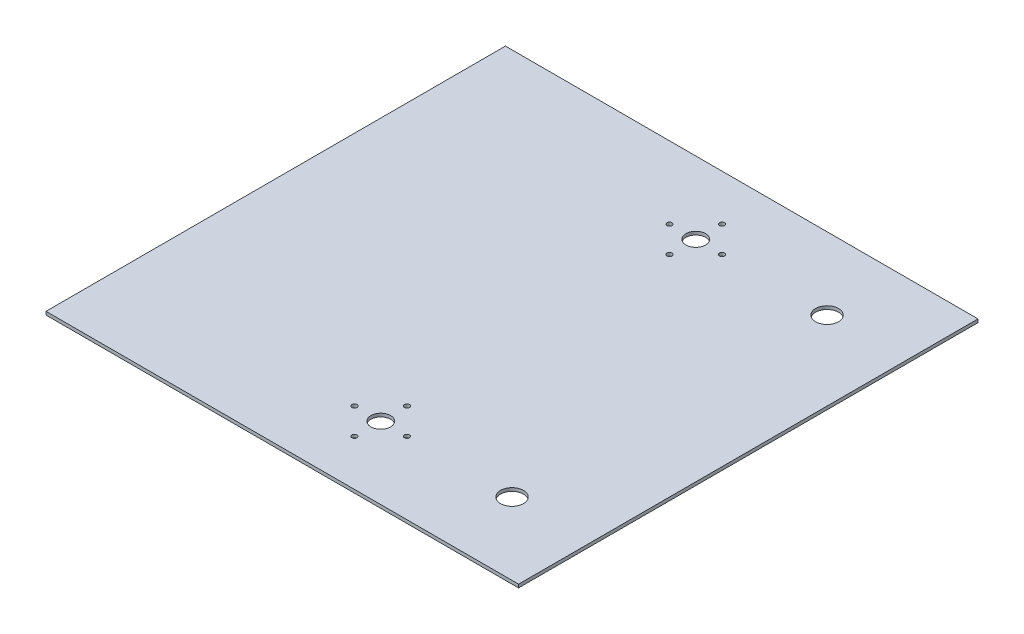
from build123d import *

# Parameters (mm, degrees)
SKETCH1_W                    = 457.2
SKETCH1_H                    = 444.5
BOSS_EXTRUDE1_DEPTH          = 3.175
CUT_EXTRUDE2_DEPTH           = 319.8465197
F_10_0_1935_DIAMETER_HOLE1_D = 4.9149
SKETCH7_R                    = 11.1125
CUT_EXTRUDE3_DEPTH           = 319.8465197


with BuildPart() as part:
    # Sketch1 → Boss-Extrude1 (new body)
    with BuildSketch(Plane(origin=(0, 0, 0), x_dir=(1, 0, 0), z_dir=(0, 1, 0))):
        Rectangle(SKETCH1_W, SKETCH1_H)
    extrude(amount=BOSS_EXTRUDE1_DEPTH)

    # Sketch3 → Cut-Extrude2 (cut, through all)
    with BuildSketch(Plane(origin=(0, 3.175, 0), x_dir=(1, 0, 0), z_dir=(0, 1, 0))):
        with BuildLine():
            ThreePointArc((34.925, -152.4), (25.4, -142.875), (15.875, -152.4))
            ThreePointArc((15.875, -152.4), (25.4, -161.925), (34.925, -152.4))
        make_face()
        with BuildLine():
            ThreePointArc((34.925, 152.4), (25.4, 161.925), (15.875, 152.4))
            ThreePointArc((15.875, 152.4), (25.4, 142.875), (34.925, 152.4))
        make_face()
    extrude(amount=-CUT_EXTRUDE2_DEPTH, mode=Mode.SUBTRACT)

    # #10 (0.1935) Diameter Hole1 (through all)
    with Locations(Plane(origin=(0, 3.175, 0), x_dir=(1, 0, 0), z_dir=(0, 1, 0))):
        with Locations((25.4, -177.8), (0, -152.4), (25.4, -127), (50.8, -152.4), (25.4, 177.8), (0, 152.4), (25.4, 127), (50.8, 152.4)):
            Hole(F_10_0_1935_DIAMETER_HOLE1_D / 2)

    # Sketch7 → Cut-Extrude3 (cut, through all)
    with BuildSketch(Plane(origin=(0, 3.175, 0), x_dir=(1, 0, 0), z_dir=(0, 1, 0))):
        with Locations((152.4, -152.4)):
            Circle(SKETCH7_R)
        with Locations((152.4, 152.4)):
            Circle(SKETCH7_R)
    extrude(amount=-CUT_EXTRUDE3_DEPTH, mode=Mode.SUBTRACT)


solid = part.part
